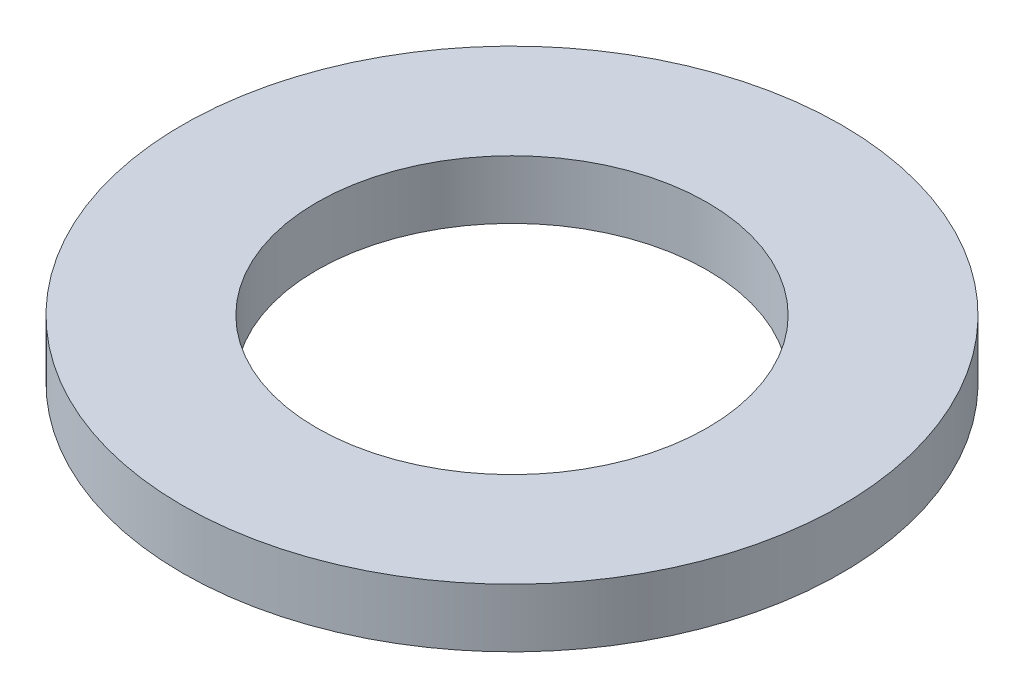
from build123d import *

# Parameters (mm, degrees)
SKETCH1_R           = 67.5
BOSS_EXTRUDE1_DEPTH = 12
SKETCH2_R           = 40
CUT_EXTRUDE1_DEPTH  = 97.210706265


with BuildPart() as part:
    # Sketch1 → Boss-Extrude1 (new body)
    with BuildSketch(Plane(origin=(0, 0, 0), x_dir=(1, 0, 0), z_dir=(0, 1, 0))):
        Circle(SKETCH1_R)
    extrude(amount=BOSS_EXTRUDE1_DEPTH)

    # Sketch2 → Cut-Extrude1 (cut, through all)
    with BuildSketch(Plane(origin=(0, 0, 0), x_dir=(1, 0, 0), z_dir=(0, 1, 0))):
        Circle(SKETCH2_R)
    extrude(amount=CUT_EXTRUDE1_DEPTH, mode=Mode.SUBTRACT)


solid = part.part
